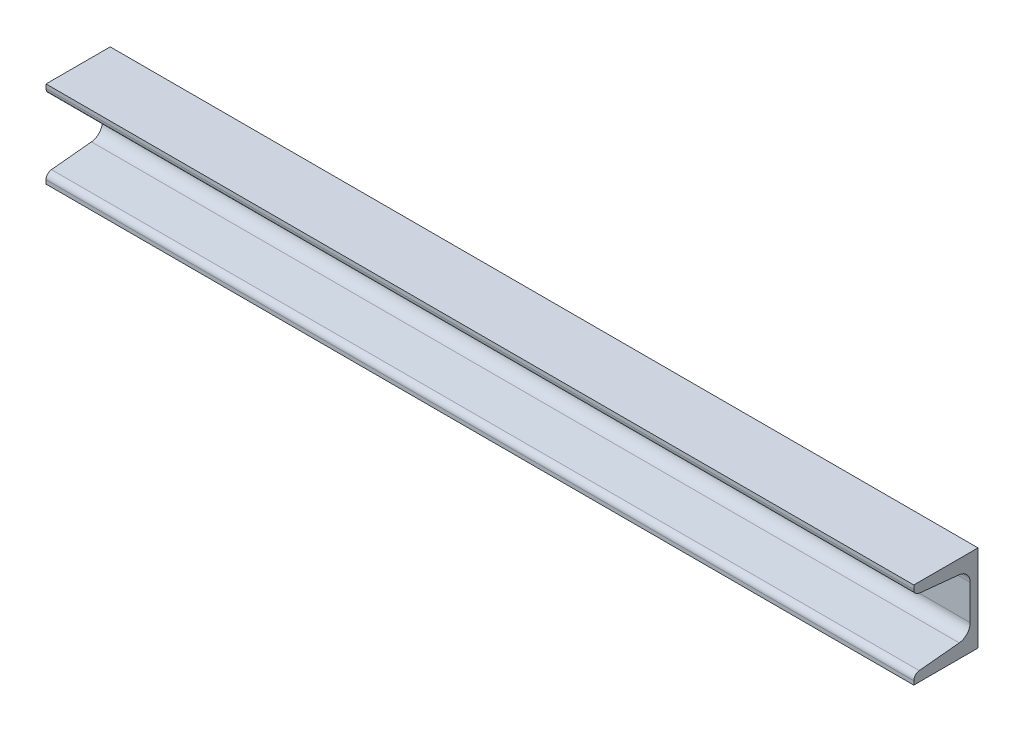
from build123d import *

# Parameters (mm, degrees)
BASE_DEPTH = 500
FILLET1_R  = 7
FILLET2_R  = 3.5


with BuildPart() as part:
    # Sketch1 → Base (new body)
    with BuildSketch(Plane(origin=(0, 0, -28.211262136), x_dir=(0, 0, 1), z_dir=(1, 0, 0))):
        Polygon((28.211262136, -25), (28.211262136, 25), (65.211262136, 25), (65.211262136, 19.625), (32.711262136, 16.375), (32.711262136, -16.375), (65.211262136, -19.625), (65.211262136, -25), align=None)
    extrude(amount=BASE_DEPTH)

    # Fillet1
    fillet1_edges = [part.edges().sort_by_distance(p)[0] for p in [
        (250, -16.375, 4.5),
        (250, 16.375, 4.5),
    ]]
    fillet(fillet1_edges, radius=FILLET1_R)

    # Fillet2
    fillet2_edges = [part.edges().sort_by_distance(p)[0] for p in [
        (250, -19.625, 37),
        (250, 19.625, 37),
    ]]
    fillet(fillet2_edges, radius=FILLET2_R)


solid = part.part
